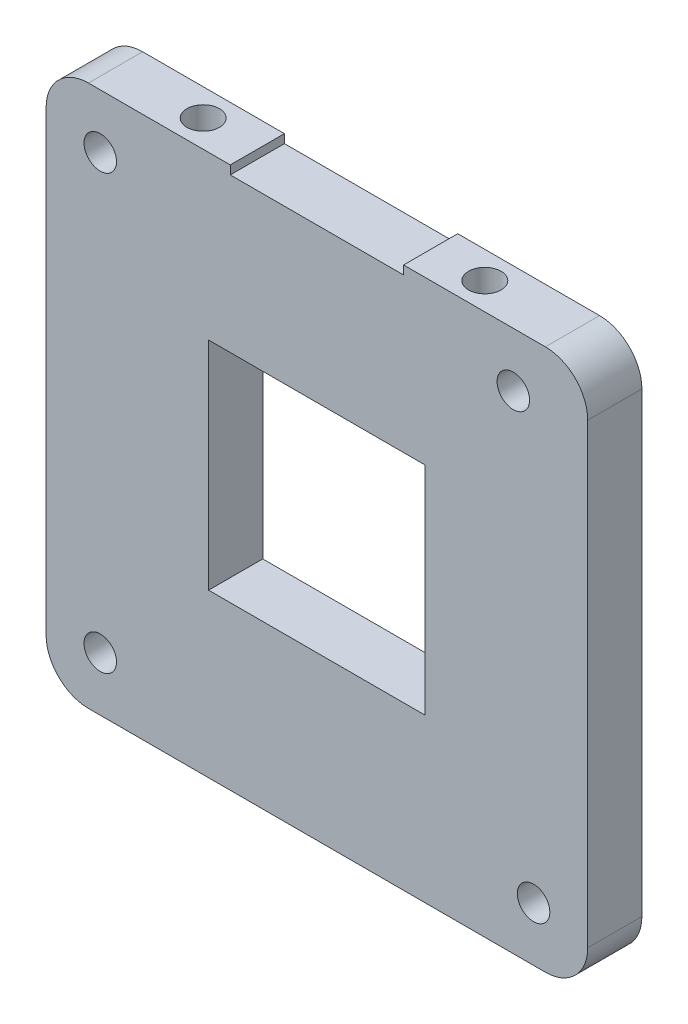
from build123d import *

# Parameters (mm, degrees)
BOSS_EXTRUDE1_DEPTH = 5
SKETCH2_W           = 20
SKETCH2_H           = 20
CUT_EXTRUDE1_DEPTH  = 5
SKETCH5_R           = 1.5
CUT_EXTRUDE2_DEPTH  = 36.707142143
SKETCH6_W           = 16
SKETCH6_H           = 0.8
CUT_EXTRUDE3_DEPTH  = 36.707142143
SKETCH7_R           = 1.5
CUT_EXTRUDE4_DEPTH  = 5


with BuildPart() as part:
    # Sketch1 → Boss-Extrude1 (new body)
    with BuildSketch(Plane.XY):
        with BuildLine():
            Line((-21.09, 25), (21.09, 25))
            ThreePointArc((21.09, 25), (23.854787514, 23.854787514), (25, 21.09))
            Line((25, 21.09), (25, -21.09))
            ThreePointArc((25, -21.09), (23.854787514, -23.854787514), (21.09, -25))
            Line((21.09, -25), (20.757353845, -25))
            Line((20.757353845, -25), (-21.09, -25))
            ThreePointArc((-21.09, -25), (-23.854787514, -23.854787514), (-25, -21.09))
            Line((-25, -21.09), (-25, 21.09))
            ThreePointArc((-25, 21.09), (-23.854787514, 23.854787514), (-21.09, 25))
        make_face()
    extrude(amount=BOSS_EXTRUDE1_DEPTH)

    # Sketch2 → Cut-Extrude1 (cut)
    with BuildSketch(Plane.XY.offset(5)):
        Rectangle(SKETCH2_W, SKETCH2_H)
    extrude(amount=-CUT_EXTRUDE1_DEPTH, mode=Mode.SUBTRACT)

    # Sketch5 → Cut-Extrude2 (cut, through all)
    with BuildSketch(Plane.XY.offset(5)):
        with Locations((-20, 20)):
            Circle(SKETCH5_R)
        with Locations((18.13054205, 20)):
            Circle(SKETCH5_R)
        with Locations((-20, -20)):
            Circle(SKETCH5_R)
        with Locations((20, -20)):
            Circle(SKETCH5_R)
    extrude(amount=-CUT_EXTRUDE2_DEPTH, mode=Mode.SUBTRACT)

    # Sketch6 → Cut-Extrude3 (cut, through all)
    with BuildSketch(Plane(origin=(0, 0, 0), x_dir=(-1, 0, 0), z_dir=(0, 0, -1))):
        with Locations((0, 24.6)):
            Rectangle(SKETCH6_W, SKETCH6_H)
    extrude(amount=-CUT_EXTRUDE3_DEPTH, mode=Mode.SUBTRACT)

    # Sketch7 → Cut-Extrude4 (cut)
    with BuildSketch(Plane(origin=(0, 25, 0), x_dir=(1, 0, 0), z_dir=(0, 1, 0))):
        with Locations((-13, -2.5)):
            Circle(SKETCH7_R)
        with Locations((13, -2.5)):
            Circle(SKETCH7_R)
    extrude(amount=-CUT_EXTRUDE4_DEPTH, mode=Mode.SUBTRACT)


solid = part.part
